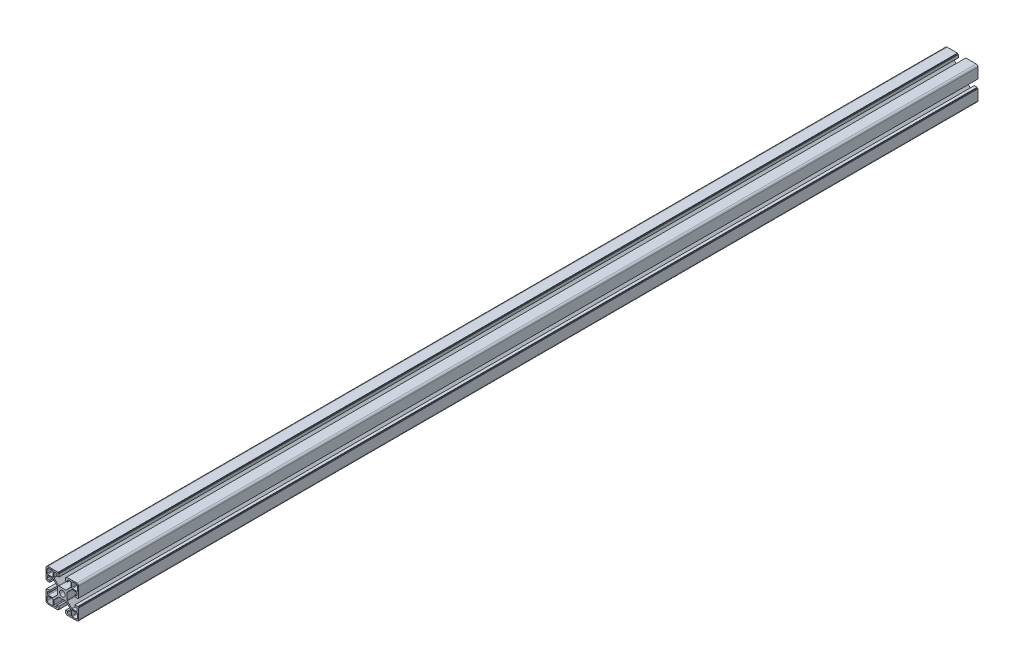
from build123d import *

# Parameters (mm, degrees)
SKETCH1_R           = 3.4
BOSS_EXTRUDE1_DEPTH = 1100


with BuildPart() as part:
    # Sketch1 → Boss-Extrude1 (new body)
    with BuildSketch(Plane.XY):
        with BuildLine():
            Line((20, 17.75), (20, 5.15))
            Line((20, 5.15), (19, 5.15))
            Line((19, 5.15), (19, 4.15))
            Line((19, 4.15), (15.4, 4.15))
            Line((15.4, 4.15), (15.4, 6.35))
            Line((15.4, 6.35), (16.95, 6.35))
            ThreePointArc((16.95, 6.35), (17.833883476, 6.716116524), (18.2, 7.6))
            Line((18.2, 7.6), (18.2, 9.3))
            ThreePointArc((18.2, 9.3), (17.907106781, 10.007106781), (17.2, 10.3))
            Line((17.2, 10.3), (12.03669957, 10.3))
            ThreePointArc((12.03669957, 10.3), (11.73040037, 10.239040459), (11.470780817, 10.065452001))
            Line((11.470780817, 10.065452001), (6.084081247, 4.674305984))
            ThreePointArc((6.084081247, 4.674305984), (5.910833239, 4.414848262), (5.85, 4.108853983))
            Line((5.85, 4.108853983), (5.85, -4.108853983))
            ThreePointArc((5.85, -4.108853983), (5.910833239, -4.414848262), (6.084081247, -4.674305984))
            Line((6.084081247, -4.674305984), (11.470780817, -10.065452001))
            ThreePointArc((11.470780817, -10.065452001), (11.73040037, -10.239040459), (12.03669957, -10.3))
            Line((12.03669957, -10.3), (17.2, -10.3))
            ThreePointArc((17.2, -10.3), (17.907106781, -10.007106781), (18.2, -9.3))
            Line((18.2, -9.3), (18.2, -7.6))
            ThreePointArc((18.2, -7.6), (17.833883476, -6.716116524), (16.95, -6.35))
            Line((16.95, -6.35), (15.4, -6.35))
            Line((15.4, -6.35), (15.4, -4.15))
            Line((15.4, -4.15), (19, -4.15))
            Line((19, -4.15), (19, -5.15))
            Line((19, -5.15), (20, -5.15))
            Line((20, -5.15), (20, -17.75))
            ThreePointArc((20, -17.75), (19.340990258, -19.340990258), (17.75, -20))
            Line((17.75, -20), (5.15, -20))
            Line((5.15, -20), (5.15, -19))
            Line((5.15, -19), (4.15, -19))
            Line((4.15, -19), (4.15, -15.4))
            Line((4.15, -15.4), (6.35, -15.4))
            Line((6.35, -15.4), (6.35, -16.95))
            ThreePointArc((6.35, -16.95), (6.716116524, -17.833883476), (7.6, -18.2))
            Line((7.6, -18.2), (9.3, -18.2))
            ThreePointArc((9.3, -18.2), (10.007106781, -17.907106781), (10.3, -17.2))
            Line((10.3, -17.2), (10.3, -12.054477022))
            ThreePointArc((10.3, -12.054477022), (10.239166761, -11.748482743), (10.065918753, -11.489025021))
            Line((10.065918753, -11.489025021), (4.665899173, -6.084547999))
            ThreePointArc((4.665899173, -6.084547999), (4.406279619, -5.910959541), (4.09998042, -5.85))
            Line((4.09998042, -5.85), (-4.09998042, -5.85))
            ThreePointArc((-4.09998042, -5.85), (-4.406279619, -5.910959541), (-4.665899173, -6.084547999))
            Line((-4.665899173, -6.084547999), (-10.065918753, -11.489025021))
            ThreePointArc((-10.065918753, -11.489025021), (-10.239166761, -11.748482743), (-10.3, -12.054477022))
            Line((-10.3, -12.054477022), (-10.3, -17.2))
            ThreePointArc((-10.3, -17.2), (-10.007106781, -17.907106781), (-9.3, -18.2))
            Line((-9.3, -18.2), (-7.6, -18.2))
            ThreePointArc((-7.6, -18.2), (-6.716116524, -17.833883476), (-6.35, -16.95))
            Line((-6.35, -16.95), (-6.35, -15.4))
            Line((-6.35, -15.4), (-4.15, -15.4))
            Line((-4.15, -15.4), (-4.15, -19))
            Line((-4.15, -19), (-5.15, -19))
            Line((-5.15, -19), (-5.15, -20))
            Line((-5.15, -20), (-17.75, -20))
            ThreePointArc((-17.75, -20), (-19.340990258, -19.340990258), (-20, -17.75))
            Line((-20, -17.75), (-20, -5.15))
            Line((-20, -5.15), (-19, -5.15))
            Line((-19, -5.15), (-19, -4.15))
            Line((-19, -4.15), (-15.4, -4.15))
            Line((-15.4, -4.15), (-15.4, -6.35))
            Line((-15.4, -6.35), (-16.95, -6.35))
            ThreePointArc((-16.95, -6.35), (-17.833883476, -6.716116524), (-18.2, -7.6))
            Line((-18.2, -7.6), (-18.2, -9.3))
            ThreePointArc((-18.2, -9.3), (-17.907106781, -10.007106781), (-17.2, -10.3))
            Line((-17.2, -10.3), (-12.03669957, -10.3))
            ThreePointArc((-12.03669957, -10.3), (-11.73040037, -10.239040459), (-11.470780817, -10.065452001))
            Line((-11.470780817, -10.065452001), (-6.084081247, -4.674305984))
            ThreePointArc((-6.084081247, -4.674305984), (-5.910833239, -4.414848262), (-5.85, -4.108853983))
            Line((-5.85, -4.108853983), (-5.85, 4.108853983))
            ThreePointArc((-5.85, 4.108853983), (-5.910833239, 4.414848262), (-6.084081247, 4.674305984))
            Line((-6.084081247, 4.674305984), (-11.470780817, 10.065452001))
            ThreePointArc((-11.470780817, 10.065452001), (-11.73040037, 10.239040459), (-12.03669957, 10.3))
            Line((-12.03669957, 10.3), (-17.2, 10.3))
            ThreePointArc((-17.2, 10.3), (-17.907106781, 10.007106781), (-18.2, 9.3))
            Line((-18.2, 9.3), (-18.2, 7.6))
            ThreePointArc((-18.2, 7.6), (-17.833883476, 6.716116524), (-16.95, 6.35))
            Line((-16.95, 6.35), (-15.4, 6.35))
            Line((-15.4, 6.35), (-15.4, 4.15))
            Line((-15.4, 4.15), (-19, 4.15))
            Line((-19, 4.15), (-19, 5.15))
            Line((-19, 5.15), (-20, 5.15))
            Line((-20, 5.15), (-20, 17.75))
            ThreePointArc((-20, 17.75), (-19.340990258, 19.340990258), (-17.75, 20))
            Line((-17.75, 20), (-5.15, 20))
            Line((-5.15, 20), (-5.15, 19))
            Line((-5.15, 19), (-4.15, 19))
            Line((-4.15, 19), (-4.15, 15.4))
            Line((-4.15, 15.4), (-6.35, 15.4))
            Line((-6.35, 15.4), (-6.35, 16.95))
            ThreePointArc((-6.35, 16.95), (-6.716116524, 17.833883476), (-7.6, 18.2))
            Line((-7.6, 18.2), (-9.3, 18.2))
            ThreePointArc((-9.3, 18.2), (-10.007106781, 17.907106781), (-10.3, 17.2))
            Line((-10.3, 17.2), (-10.3, 12.054477022))
            ThreePointArc((-10.3, 12.054477022), (-10.239166761, 11.748482743), (-10.065918753, 11.489025021))
            Line((-10.065918753, 11.489025021), (-4.665899173, 6.084547999))
            ThreePointArc((-4.665899173, 6.084547999), (-4.406279619, 5.910959541), (-4.09998042, 5.85))
            Line((-4.09998042, 5.85), (4.09998042, 5.85))
            ThreePointArc((4.09998042, 5.85), (4.406279619, 5.910959541), (4.665899173, 6.084547999))
            Line((4.665899173, 6.084547999), (10.065918753, 11.489025021))
            ThreePointArc((10.065918753, 11.489025021), (10.239166761, 11.748482743), (10.3, 12.054477022))
            Line((10.3, 12.054477022), (10.3, 17.2))
            ThreePointArc((10.3, 17.2), (10.007106781, 17.907106781), (9.3, 18.2))
            Line((9.3, 18.2), (7.6, 18.2))
            ThreePointArc((7.6, 18.2), (6.716116524, 17.833883476), (6.35, 16.95))
            Line((6.35, 16.95), (6.35, 15.4))
            Line((6.35, 15.4), (4.15, 15.4))
            Line((4.15, 15.4), (4.15, 19))
            Line((4.15, 19), (5.15, 19))
            Line((5.15, 19), (5.15, 20))
            Line((5.15, 20), (17.75, 20))
            ThreePointArc((17.75, 20), (19.340990258, 19.340990258), (20, 17.75))
        make_face()
        Circle(SKETCH1_R, mode=Mode.SUBTRACT)
        with BuildLine():
            Line((18.6, 16.35), (18.6, 12.2))
            ThreePointArc((18.6, 12.2), (18.365685425, 11.634314575), (17.8, 11.4))
            Line((17.8, 11.4), (12.2, 11.4))
            ThreePointArc((12.2, 11.4), (11.634314575, 11.634314575), (11.4, 12.2))
            Line((11.4, 12.2), (11.4, 17.8))
            ThreePointArc((11.4, 17.8), (11.634314575, 18.365685425), (12.2, 18.6))
            Line((12.2, 18.6), (16.35, 18.6))
            ThreePointArc((16.35, 18.6), (17.940990258, 17.940990258), (18.6, 16.35))
        make_face(mode=Mode.SUBTRACT)
        with BuildLine():
            Line((-12.2, 18.6), (-16.35, 18.6))
            ThreePointArc((-16.35, 18.6), (-17.940990258, 17.940990258), (-18.6, 16.35))
            Line((-18.6, 16.35), (-18.6, 12.2))
            ThreePointArc((-18.6, 12.2), (-18.365685425, 11.634314575), (-17.8, 11.4))
            Line((-17.8, 11.4), (-12.2, 11.4))
            ThreePointArc((-12.2, 11.4), (-11.634314575, 11.634314575), (-11.4, 12.2))
            Line((-11.4, 12.2), (-11.4, 17.8))
            ThreePointArc((-11.4, 17.8), (-11.634314575, 18.365685425), (-12.2, 18.6))
        make_face(mode=Mode.SUBTRACT)
        with BuildLine():
            Line((-18.6, -16.35), (-18.6, -12.2))
            ThreePointArc((-18.6, -12.2), (-18.365685425, -11.634314575), (-17.8, -11.4))
            Line((-17.8, -11.4), (-12.2, -11.4))
            ThreePointArc((-12.2, -11.4), (-11.634314575, -11.634314575), (-11.4, -12.2))
            Line((-11.4, -12.2), (-11.4, -17.8))
            ThreePointArc((-11.4, -17.8), (-11.634314575, -18.365685425), (-12.2, -18.6))
            Line((-12.2, -18.6), (-16.35, -18.6))
            ThreePointArc((-16.35, -18.6), (-17.940990258, -17.940990258), (-18.6, -16.35))
        make_face(mode=Mode.SUBTRACT)
        with BuildLine():
            Line((12.2, -18.6), (16.35, -18.6))
            ThreePointArc((16.35, -18.6), (17.940990258, -17.940990258), (18.6, -16.35))
            Line((18.6, -16.35), (18.6, -12.2))
            ThreePointArc((18.6, -12.2), (18.365685425, -11.634314575), (17.8, -11.4))
            Line((17.8, -11.4), (12.2, -11.4))
            ThreePointArc((12.2, -11.4), (11.634314575, -11.634314575), (11.4, -12.2))
            Line((11.4, -12.2), (11.4, -17.8))
            ThreePointArc((11.4, -17.8), (11.634314575, -18.365685425), (12.2, -18.6))
        make_face(mode=Mode.SUBTRACT)
    extrude(amount=BOSS_EXTRUDE1_DEPTH)


solid = part.part
